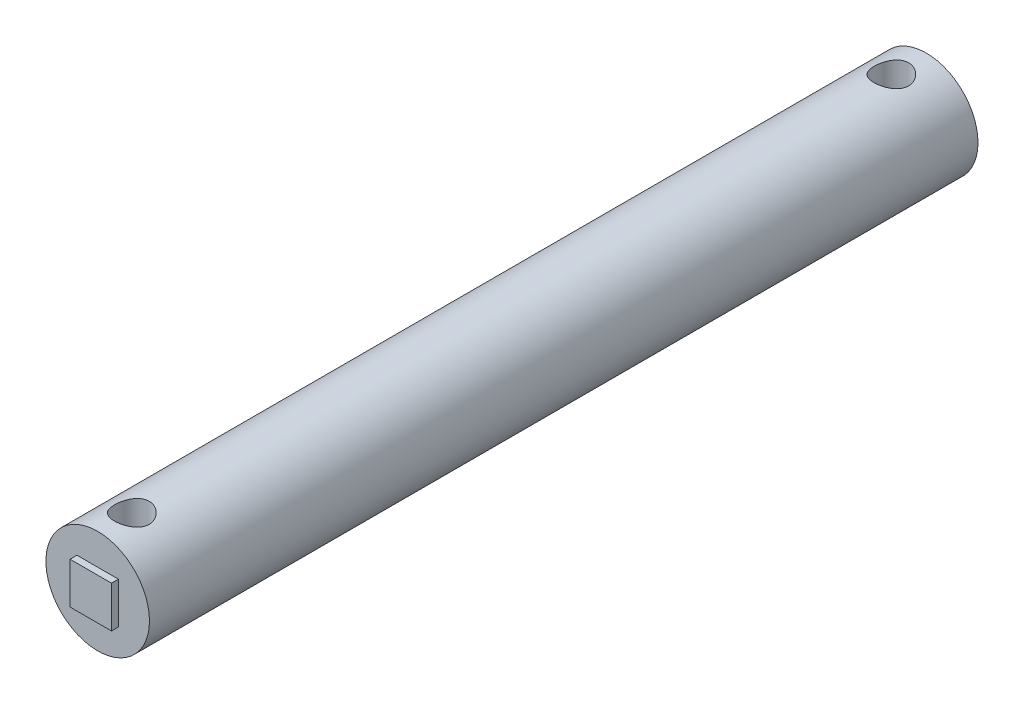
from build123d import *

# Parameters (mm, degrees)
ESQUISSE1_R                 = 7.5
BOSS_EXTRU_1_DEPTH          = 60
ESQUISSE6_W                 = 6
ESQUISSE6_H                 = 6
BOSS_EXTRU_2_DEPTH          = 1
ENL_V_MAT_EXTRU_2_OUTLINE_W = 2.5
ENL_V_MAT_EXTRU_2_OUTLINE_H = 15.000451996


# Read off the part's stored shape, not the designer's step: Enlèv. mat.-Extru.2
with BuildPart() as part:
    # Esquisse1 → Boss.-Extru.1 (new body)
    with BuildSketch(Plane.XY):
        Circle(ESQUISSE1_R)
    boss_extru_1 = extrude(amount=BOSS_EXTRU_1_DEPTH)

    # Esquisse6 → Boss.-Extru.2 (add)
    with BuildSketch(Plane(origin=(0, 0, 0), x_dir=(-1, 0, 0), z_dir=(0, 0, -1))):
        Rectangle(ESQUISSE6_W, ESQUISSE6_H)
    boss_extru_2 = extrude(amount=BOSS_EXTRU_2_DEPTH)

    # Enlèv. mat.-Extru.2 outline → Enlèv. mat.-Extru.2 (revolve, cut)
    with BuildSketch(Plane(origin=(-0.054510378, 0, 5), x_dir=(1, 0, 0), z_dir=(0, 0, 1))):
        with Locations((1.25, 0)):
            Rectangle(ENL_V_MAT_EXTRU_2_OUTLINE_W, ENL_V_MAT_EXTRU_2_OUTLINE_H)
    enl_v_mat_extru_2 = revolve(axis=Axis((-0.054510378, 0, 5), (0, 1, 0)), mode=Mode.SUBTRACT)

    # Symétrie4: Boss.-Extru.1, Boss.-Extru.2, Enlèv. mat.-Extru.2 across plane
    add(boss_extru_1.mirror(Plane.XY.offset(60)))
    add(boss_extru_2.mirror(Plane.XY.offset(60)))
    add(enl_v_mat_extru_2.mirror(Plane.XY.offset(60)), mode=Mode.SUBTRACT)


solid = part.part
